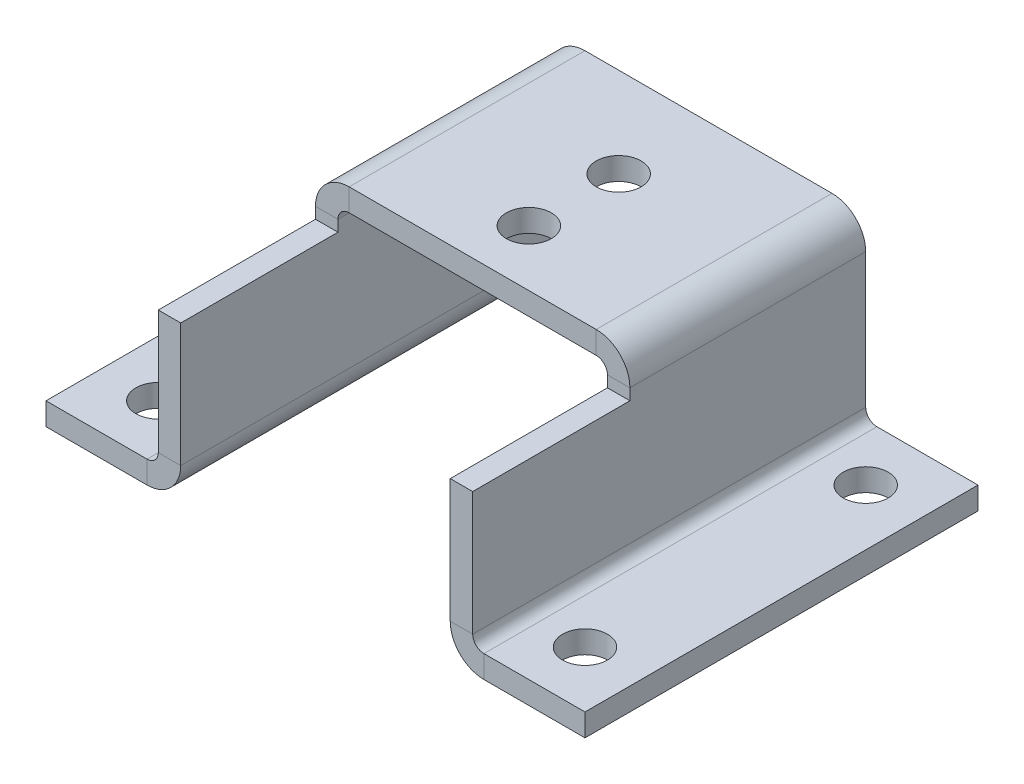
from build123d import *

# Parameters (mm, degrees)
BASE_FLANGE1_DEPTH       = 35
SKETCH6_W                = 28
SKETCH6_H                = 14
CUT_EXTRUDE1_DEPTH       = 4
F_4_0_4_DIAMETER_HOLE1_D = 4


# Sheet-metal steps are written as plain solids
with BuildPart() as part:
    # Sketch1 → Base-Flange1 (new body)
    with BuildSketch(Plane.XY):
        with BuildLine():
            Line((0, 0), (-9, 0))
            ThreePointArc((-9, 0), (-11.121320344, 0.878679656), (-12, 3))
            Line((-12, 3), (-12, 15))
            ThreePointArc((-12, 15), (-12.292893219, 15.707106781), (-13, 16))
            Line((-13, 16), (-35, 16))
            ThreePointArc((-35, 16), (-35.707106781, 15.707106781), (-36, 15))
            Line((-36, 15), (-36, 3))
            ThreePointArc((-36, 3), (-36.878679656, 0.878679656), (-39, 0))
            Line((-39, 0), (-48, 0))
            Line((-48, 0), (-48, 2))
            Line((-48, 2), (-39, 2))
            ThreePointArc((-39, 2), (-38.292893219, 2.292893219), (-38, 3))
            Line((-38, 3), (-38, 15))
            ThreePointArc((-38, 15), (-37.121320344, 17.121320344), (-35, 18))
            Line((-35, 18), (-13, 18))
            ThreePointArc((-13, 18), (-10.878679656, 17.121320344), (-10, 15))
            Line((-10, 15), (-10, 3))
            ThreePointArc((-10, 3), (-9.707106781, 2.292893219), (-9, 2))
            Line((-9, 2), (0, 2))
            Line((0, 2), (0, 0))
        make_face()
    extrude(amount=-BASE_FLANGE1_DEPTH)

    # Sketch6 → Cut-Extrude1 (cut)
    with BuildSketch(Plane(origin=(0, 18, 0), x_dir=(1, 0, 0), z_dir=(0, 1, 0))):
        with Locations((-24, 7)):
            Rectangle(SKETCH6_W, SKETCH6_H)
    extrude(amount=-CUT_EXTRUDE1_DEPTH, mode=Mode.SUBTRACT)

    # Ø4.0 (4) Diameter Hole1 (through all)
    with Locations(Plane(origin=(0, 18, 0), x_dir=(1, 0, 0), z_dir=(0, 1, 0))):
        with Locations((-5, 5), (-5, 30), (-24, 19), (-24, 27), (-43, 5), (-43, 30)):
            Hole(F_4_0_4_DIAMETER_HOLE1_D / 2)


solid = part.part
